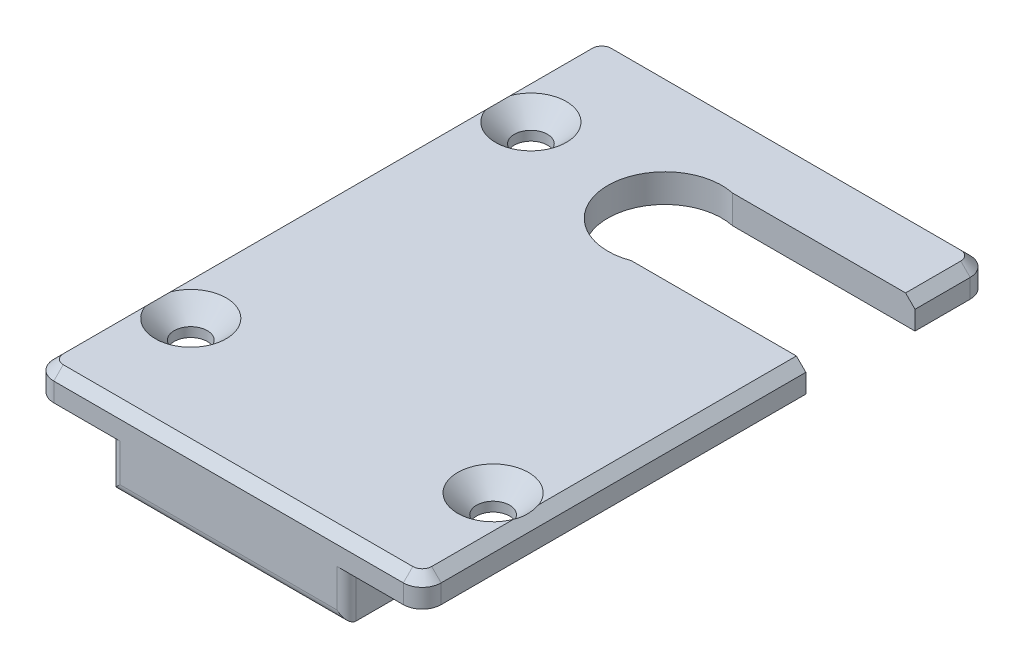
from build123d import *

# Parameters (mm, degrees)
SKETCH_1_W          = 41
SKETCH_1_H          = 60
EXTRUDE_1_DEPTH     = 3
SKETCH_2_R          = 1.75
CUT_EXTRUDE_1_DEPTH = 3
FILLET_1_R          = 2
SKETCH_3_W          = 25
SKETCH_3_H          = 8
EXTRUDE_2_DEPTH     = 5
FILLET_2_R          = 1
CHAMFER_2_SIZE      = 1
CHAMFER_1_SIZE      = 2
CUT_EXTRUDE_3_DEPTH = 10


with BuildPart() as part:
    # Эскиз1 → Бобышка-Вытянуть1 (new body)
    with BuildSketch(Plane(origin=(0, 0, 0), x_dir=(1, 0, 0), z_dir=(0, 1, 0))):
        Rectangle(SKETCH_1_W, SKETCH_1_H)
    extrude(amount=EXTRUDE_1_DEPTH)

    # Эскиз2 → Вырез-Вытянуть1 (cut)
    with BuildSketch(Plane(origin=(0, 3, 0), x_dir=(1, 0, 0), z_dir=(0, 1, 0))):
        with Locations(Location((16, 18, 0), (0, 0, 270))):
            Circle(SKETCH_2_R)
        with Locations(Location((16, -18, 0), (0, 0, 90))):
            Circle(SKETCH_2_R)
        with Locations(Location((-16, -18, 0), (0, 0, 270))):
            Circle(SKETCH_2_R)
        with Locations(Location((-16, 18, 0), (0, 0, 90))):
            Circle(SKETCH_2_R)
    extrude(amount=-CUT_EXTRUDE_1_DEPTH, mode=Mode.SUBTRACT)

    # Скругление1
    fillet_1_edges = [part.edges().sort_by_distance(p)[0] for p in [
        (20.5, 1.5, 30),
        (-20.5, 1.5, 30),
        (-20.5, 1.5, -30),
        (20.5, 1.5, -30),
    ]]
    fillet(fillet_1_edges, radius=FILLET_1_R)

    # Эскиз3 → Бобышка-Вытянуть2 (add)
    with BuildSketch(Plane.XZ):
        with Locations((0, 26)):
            Rectangle(SKETCH_3_W, SKETCH_3_H)
    extrude(amount=EXTRUDE_2_DEPTH)

    # Скругление2
    fillet_2_edges = [part.edges().sort_by_distance(p)[0] for p in [
        (12.5, -2.5, 30),
        (-12.5, -2.5, 30),
        (0, -5, 30),
    ]]
    fillet(fillet_2_edges, radius=FILLET_2_R)

    # Фаска2
    chamfer_2_edges = [part.edges().sort_by_distance(p)[0] for p in [
        (0, 3, -30),
        (20.5, 3, 0),
        (-20.5, 3, 0),
        (0, 3, 30),
        (19.914213562, 3, 29.414213562),
        (-19.914213562, 3, 29.414213562),
        (-19.914213562, 3, -29.414213562),
        (19.914213562, 3, -29.414213562),
    ]]
    chamfer(chamfer_2_edges, length=CHAMFER_2_SIZE)

    # Фаска1
    # the kernel refuses this chamfer: 2 mm, written as the material it takes off along each edge
    with BuildSketch(Plane(origin=(-16, 3, -18), x_dir=(0, 0, -1), z_dir=(1, 0, 0))) as chamfer_1_piece_1:
        Polygon((1.75 + CHAMFER_1_SIZE, 0), (1.75, -CHAMFER_1_SIZE), (1.75, 0), align=None)
    revolve(axis=Axis((-16, 3, -18), (0, 1, 0)), mode=Mode.SUBTRACT)
    with BuildSketch(Plane(origin=(-16, 3, 18), x_dir=(0, 0, 1), z_dir=(-1, 0, 0))) as chamfer_1_piece_2:
        Polygon((1.75 + CHAMFER_1_SIZE, 0), (1.75, -CHAMFER_1_SIZE), (1.75, 0), align=None)
    revolve(axis=Axis((-16, 3, 18), (0, 1, 0)), mode=Mode.SUBTRACT)
    with BuildSketch(Plane(origin=(16, 3, 18), x_dir=(0, 0, -1), z_dir=(1, 0, 0))) as chamfer_1_piece_3:
        Polygon((1.75 + CHAMFER_1_SIZE, 0), (1.75, -CHAMFER_1_SIZE), (1.75, 0), align=None)
    revolve(axis=Axis((16, 3, 18), (0, 1, 0)), mode=Mode.SUBTRACT)
    with BuildSketch(Plane(origin=(16, 3, -18), x_dir=(0, 0, 1), z_dir=(-1, 0, 0))) as chamfer_1_piece_4:
        Polygon((1.75 + CHAMFER_1_SIZE, 0), (1.75, -CHAMFER_1_SIZE), (1.75, 0), align=None)
    revolve(axis=Axis((16, 3, -18), (0, 1, 0)), mode=Mode.SUBTRACT)

    # Эскиз4 → Вырез-Вытянуть3 (cut)
    with BuildSketch(Plane(origin=(0, 3, 0), x_dir=(1, 0, 0), z_dir=(0, 1, 0))):
        with BuildLine():
            Line((23.418596888, 22.157492631), (1.187361352, 22.157492631))
            ThreePointArc((1.187361352, 22.157492631), (-6.100332896, 15.822023301), (2.023513442, 10.60169958))
            Line((2.023513442, 10.60169958), (23.418596888, 10.60169958))
            Line((23.418596888, 10.60169958), (23.418596888, 22.157492631))
        make_face()
    extrude(amount=-CUT_EXTRUDE_3_DEPTH, mode=Mode.SUBTRACT)


solid = part.part
